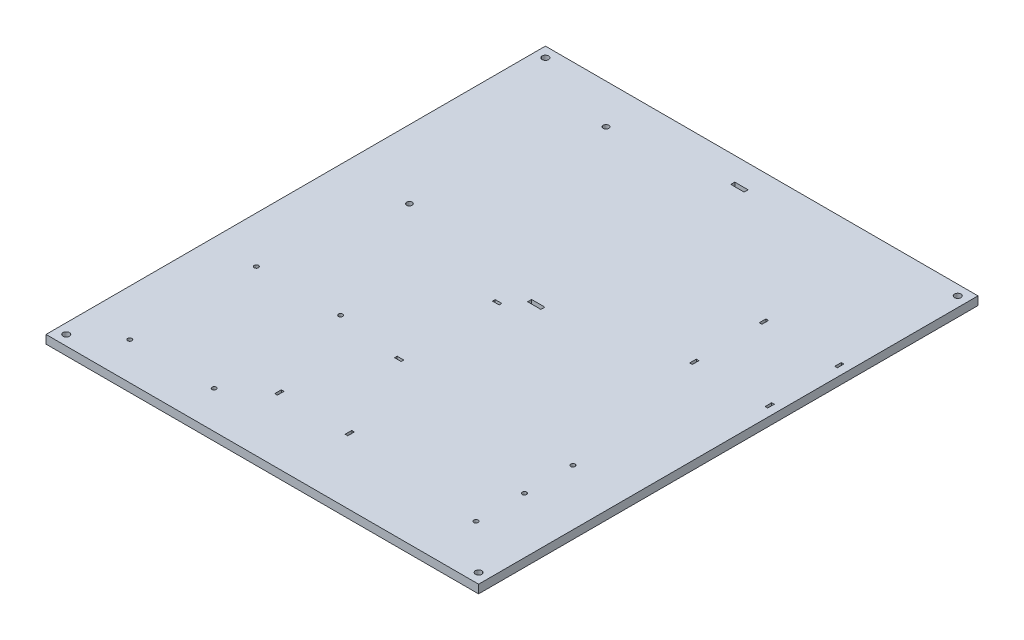
from build123d import *

# Parameters (mm, degrees)
SKETCH1_W      = 325.7
SKETCH1_H      = 376
SKETCH1_R      = 2.413
SKETCH1_R_2    = 2.0828
SKETCH1_R_3    = 1.5875
SKETCH1_R_4    = 1.6256
SKETCH1_W_2    = 10
SKETCH1_H_2    = 3
SKETCH1_W_3    = 5
SKETCH1_H_3    = 2
SKETCH1_W_4    = 2
SKETCH1_H_4    = 5
EXTRUDE1_DEPTH = 6.35


with BuildPart() as part:
    # Sketch1 → Extrude1 (new body)
    with BuildSketch(Plane(origin=(0, 0, 0), x_dir=(1, 0, 0), z_dir=(0, 1, 0))):
        with Locations((162.85, 188)):
            Rectangle(SKETCH1_W, SKETCH1_H)
        with Locations((7.62, 368.38)):
            Circle(SKETCH1_R, mode=Mode.SUBTRACT)
        with Locations((75.438, 346.1828)):
            Circle(SKETCH1_R_2, mode=Mode.SUBTRACT)
        with Locations((51.562, 222.0172)):
            Circle(SKETCH1_R_2, mode=Mode.SUBTRACT)
        with Locations((318.08, 368.38)):
            Circle(SKETCH1_R, mode=Mode.SUBTRACT)
        with Locations((7.62, 7.62)):
            Circle(SKETCH1_R, mode=Mode.SUBTRACT)
        with Locations((318.08, 7.62)):
            Circle(SKETCH1_R, mode=Mode.SUBTRACT)
        with Locations((34.925, 123.425)):
            Circle(SKETCH1_R_3, mode=Mode.SUBTRACT)
        with Locations((98.425, 123.425)):
            Circle(SKETCH1_R_3, mode=Mode.SUBTRACT)
        with Locations((34.925, 28.175104068)):
            Circle(SKETCH1_R_3, mode=Mode.SUBTRACT)
        with Locations((98.425, 28.175104068)):
            Circle(SKETCH1_R_3, mode=Mode.SUBTRACT)
        with Locations((283.7, 113)):
            Circle(SKETCH1_R_4, mode=Mode.SUBTRACT)
        with Locations((283.7, 40)):
            Circle(SKETCH1_R_4, mode=Mode.SUBTRACT)
        with Locations((283.7, 76.5)):
            Circle(SKETCH1_R_4, mode=Mode.SUBTRACT)
        with Locations((165, 204.1)):
            Rectangle(SKETCH1_W_2, SKETCH1_H_2, mode=Mode.SUBTRACT)
        with Locations((165, 357.1)):
            Rectangle(SKETCH1_W_2, SKETCH1_H_2, mode=Mode.SUBTRACT)
        with Locations((148.88, 190.8)):
            Rectangle(SKETCH1_W_3, SKETCH1_H_3, mode=Mode.SUBTRACT)
        with Locations((148.88, 117)):
            Rectangle(SKETCH1_W_3, SKETCH1_H_3, mode=Mode.SUBTRACT)
        with Locations((125.7, 50)):
            Rectangle(SKETCH1_W_4, SKETCH1_H_4, mode=Mode.SUBTRACT)
        with Locations((178.7, 50)):
            Rectangle(SKETCH1_W_4, SKETCH1_H_4, mode=Mode.SUBTRACT)
        with Locations((318.7, 226.19375)):
            Rectangle(SKETCH1_W_4, SKETCH1_H_4, mode=Mode.SUBTRACT)
        with Locations((261.9, 226.19375)):
            Rectangle(SKETCH1_W_4, SKETCH1_H_4, mode=Mode.SUBTRACT)
        with Locations((318.7, 278.58125)):
            Rectangle(SKETCH1_W_4, SKETCH1_H_4, mode=Mode.SUBTRACT)
        with Locations((261.9, 278.58125)):
            Rectangle(SKETCH1_W_4, SKETCH1_H_4, mode=Mode.SUBTRACT)
    extrude(amount=EXTRUDE1_DEPTH)


solid = part.part
